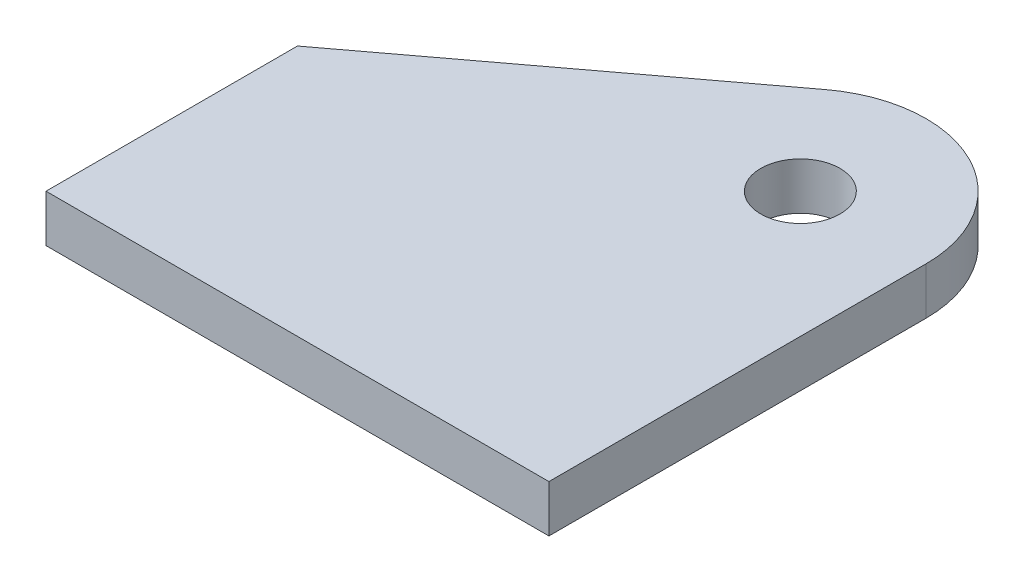
from build123d import *

# Parameters (mm, degrees)
SKETCH1_R           = 4
BOSS_EXTRUDE1_DEPTH = 4.7625


with BuildPart() as part:
    # Sketch1 → Boss-Extrude1 (new body)
    with BuildSketch(Plane(origin=(0, 0, 0), x_dir=(1, 0, 0), z_dir=(0, 1, 0))):
        with BuildLine():
            Line((0, 0), (0, 38.1))
            ThreePointArc((0, 38.1), (-7.020387337, 49.459225326), (-20.32, 48.26))
            Line((-20.32, 48.26), (-50.8, 25.4))
            Line((-50.8, 25.4), (-50.8, 0))
            Line((-50.8, 0), (0, 0))
        make_face()
        with Locations((-12.7, 38.1)):
            Circle(SKETCH1_R, mode=Mode.SUBTRACT)
    extrude(amount=BOSS_EXTRUDE1_DEPTH)


solid = part.part
